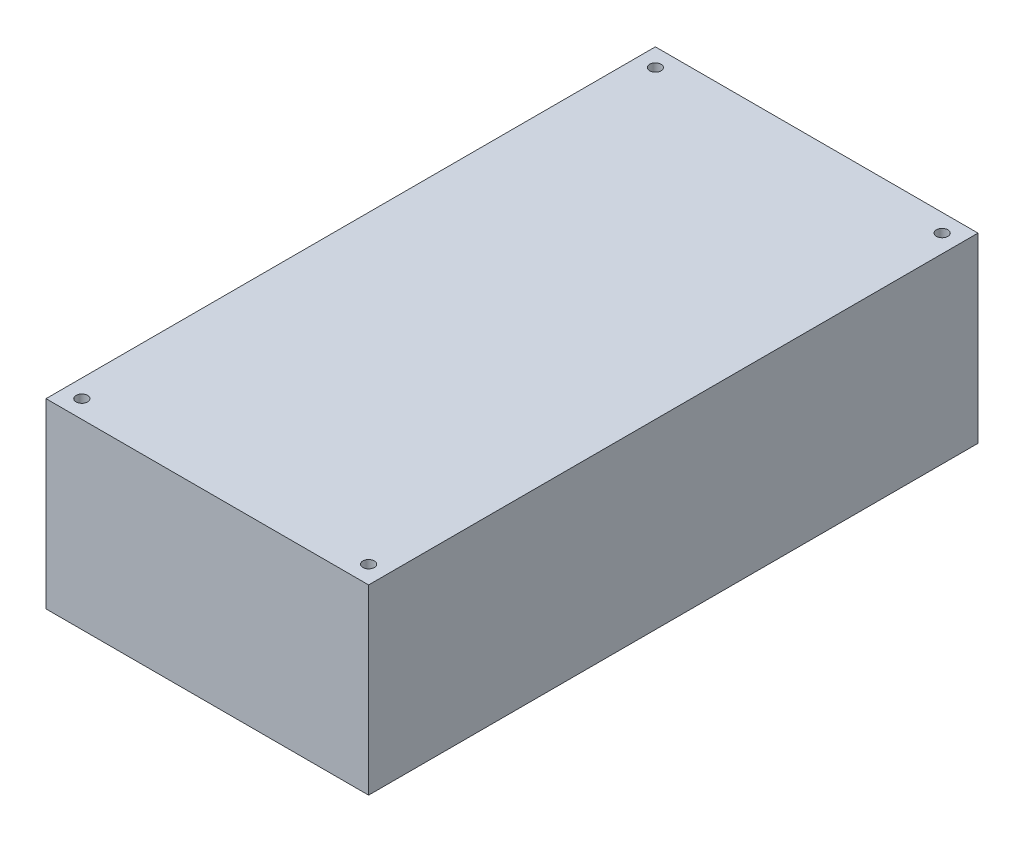
from build123d import *

# Parameters (mm, degrees)
SKETCH1_W           = 90
SKETCH1_H           = 170
BOSS_EXTRUDE1_DEPTH = 50.8
SKETCH2_R           = 1.6
CUT_EXTRUDE1_DEPTH  = 70.4


with BuildPart() as part:
    # Sketch1 → Boss-Extrude1 (new body)
    with BuildSketch(Plane(origin=(0, 0, 0), x_dir=(1, 0, 0), z_dir=(0, 1, 0))):
        with Locations((9.467759563, 24.62295082)):
            Rectangle(SKETCH1_W, SKETCH1_H)
    extrude(amount=BOSS_EXTRUDE1_DEPTH)

    # Sketch2 → Cut-Extrude1 (cut)
    with BuildSketch(Plane(origin=(0, 50.8, 0), x_dir=(1, 0, 0), z_dir=(0, 1, 0))):
        with Locations((-30.532240437, 104.62295082)):
            Circle(SKETCH2_R)
        with Locations((49.467759563, 104.62295082)):
            Circle(SKETCH2_R)
        with Locations((-30.532240437, -55.37704918)):
            Circle(SKETCH2_R)
        with Locations((49.467759563, -55.37704918)):
            Circle(SKETCH2_R)
    extrude(amount=-CUT_EXTRUDE1_DEPTH, mode=Mode.SUBTRACT)


solid = part.part
